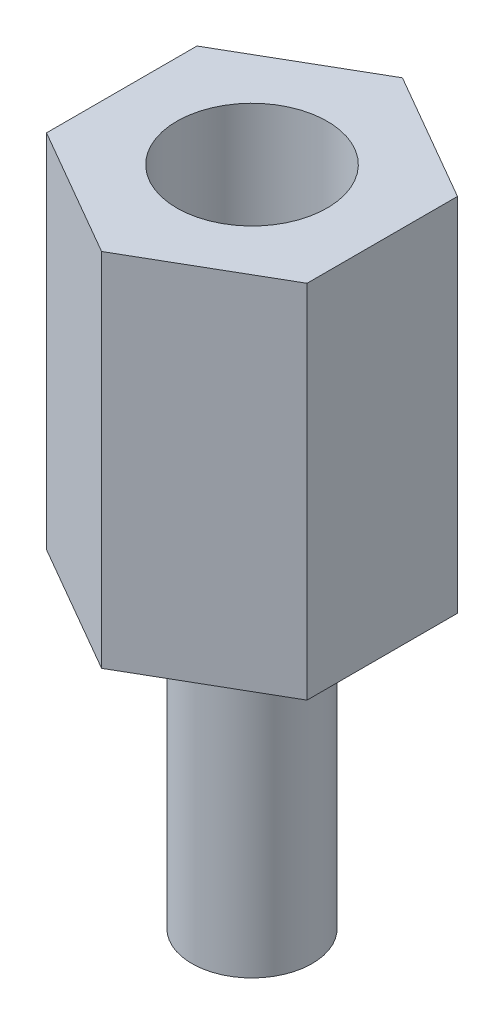
from build123d import *

# Parameters (mm, degrees)
SKETCH1_R   = 1.25
BODY_DEPTH  = 5
END_DEPTH   = 1
SKETCH3_R   = 1
SCREW_DEPTH = 5


with BuildPart() as part:
    # Sketch1 → Body (new body)
    with BuildSketch(Plane(origin=(0, 0, 0), x_dir=(1, 0, 0), z_dir=(0, 1, 0))):
        Polygon((0, 2.5), (-2.165063509, 1.25), (-2.165063509, -1.25), (0, -2.5), (2.165063509, -1.25), (2.165063509, 1.25), align=None)
        Circle(SKETCH1_R, mode=Mode.SUBTRACT)
    extrude(amount=BODY_DEPTH)

    # Sketch2 → End (add)
    with BuildSketch(Plane.XZ):
        Polygon((0, -2.5), (2.165063509, -1.25), (2.165063509, 1.25), (0, 2.5), (-2.165063509, 1.25), (-2.165063509, -1.25), align=None)
    extrude(amount=END_DEPTH)

    # Sketch3 → Screw (add)
    with BuildSketch(Plane.XZ.offset(1)):
        Circle(SKETCH3_R)
    extrude(amount=SCREW_DEPTH)


solid = part.part
